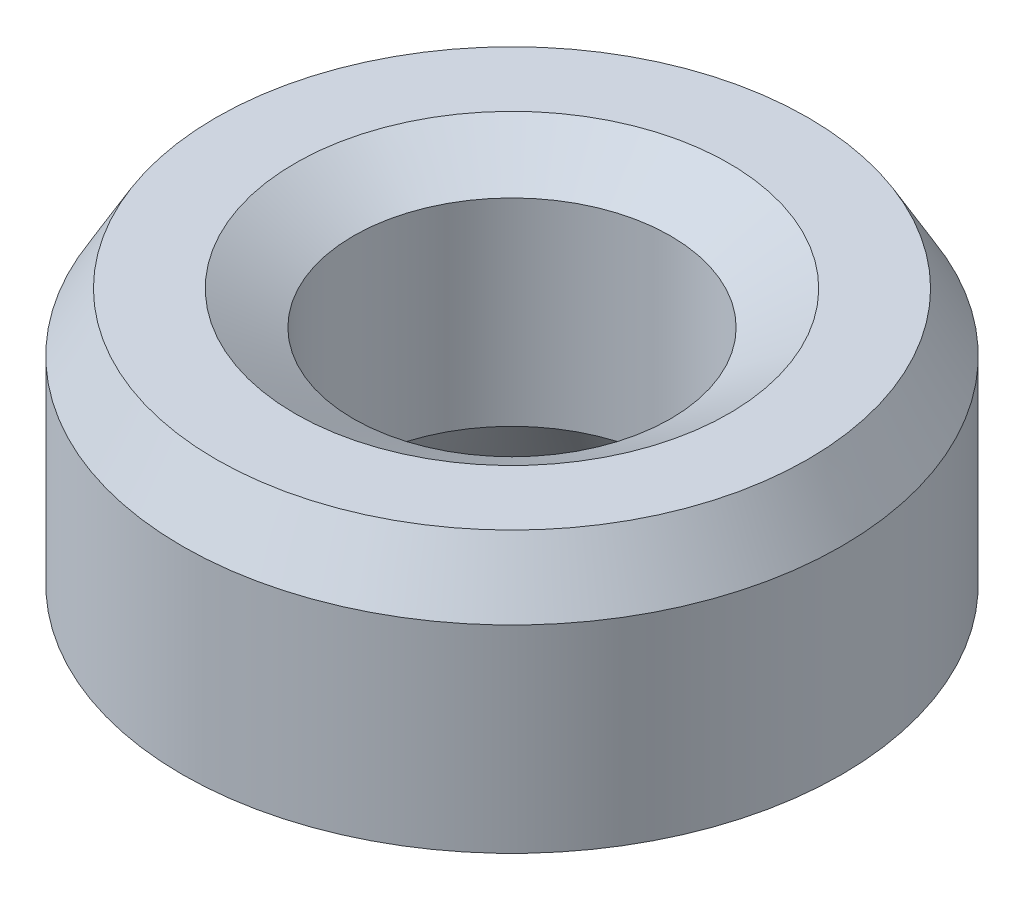
from build123d import *
from OCP.BRepFilletAPI import BRepFilletAPI_MakeChamfer

# Parameters (mm, degrees)
SKETCH1_R           = 7.5
BOSS_EXTRUDE1_DEPTH = 6.593777872
SKETCH2_R           = 3.605908602
CUT_EXTRUDE1_DEPTH  = 13.489111522
CHAMFER1_SIZE       = 1.328265732
CHAMFER1_SIZE2      = 0.766874578


with BuildPart() as part:
    # Sketch1 → Boss-Extrude1 (new body)
    with BuildSketch(Plane(origin=(0, 0, 0), x_dir=(1, 0, 0), z_dir=(0, 1, 0))):
        Circle(SKETCH1_R)
    extrude(amount=BOSS_EXTRUDE1_DEPTH)

    # Sketch2 → Cut-Extrude1 (cut, through all)
    with BuildSketch(Plane(origin=(0, 0, 0), x_dir=(1, 0, 0), z_dir=(0, 1, 0))):
        Circle(SKETCH2_R)
    extrude(amount=CUT_EXTRUDE1_DEPTH, mode=Mode.SUBTRACT)

    # Chamfer1: one chamfer whose edges measure the first distance from different faces: ONE call of the kernel's chamfer builder (chamfer() names one face for all edges)
    chamfer1_edges_1 = [part.edges().sort_by_distance(p)[0] for p in [
        (-3.605908602, 6.593777872, 0),
    ]]
    chamfer1_side_1 = [part.faces().sort_by_distance(p)[0] for p in [
        (-7.287867966, 6.593777872, 0),
    ]]
    chamfer1_edges_2 = [part.edges().sort_by_distance(p)[0] for p in [
        (-3.605908602, 0, 0),
    ]]
    chamfer1_side_2 = [part.faces().sort_by_distance(p)[0] for p in [
        (-3.605908602, 3.296888936, 0),
    ]]
    chamfer1_edges_3 = [part.edges().sort_by_distance(p)[0] for p in [
        (-7.5, 0, 0),
    ]]
    chamfer1_side_3 = [part.faces().sort_by_distance(p)[0] for p in [
        (-7.287867966, 0, 0),
    ]]
    chamfer1_edges_4 = [part.edges().sort_by_distance(p)[0] for p in [
        (-7.5, 6.593777872, 0),
    ]]
    chamfer1_side_4 = [part.faces().sort_by_distance(p)[0] for p in [
        (-7.5, 3.296888936, 0),
    ]]
    chamfer1 = BRepFilletAPI_MakeChamfer(part.part.solid().wrapped)
    for e in chamfer1_edges_1:
        chamfer1.Add(CHAMFER1_SIZE, CHAMFER1_SIZE2, e.wrapped, chamfer1_side_1[0].wrapped)  # the first distance lies on this face
    for e in chamfer1_edges_2:
        chamfer1.Add(CHAMFER1_SIZE, CHAMFER1_SIZE2, e.wrapped, chamfer1_side_2[0].wrapped)  # the first distance lies on this face
    for e in chamfer1_edges_3:
        chamfer1.Add(CHAMFER1_SIZE, CHAMFER1_SIZE2, e.wrapped, chamfer1_side_3[0].wrapped)  # the first distance lies on this face
    for e in chamfer1_edges_4:
        chamfer1.Add(CHAMFER1_SIZE, CHAMFER1_SIZE2, e.wrapped, chamfer1_side_4[0].wrapped)  # the first distance lies on this face
    add(Compound.cast(chamfer1.Shape()), mode=Mode.REPLACE)


solid = part.part
